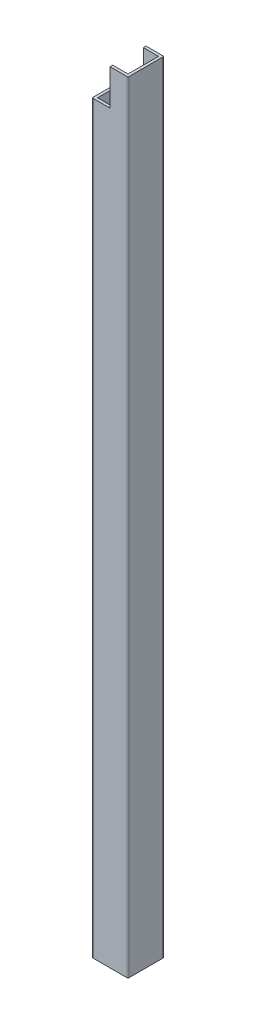
from build123d import *

# Parameters (mm, degrees)
SKETCH1_W                   = 17
SKETCH1_H                   = 17
BOSS_EXTRUDE1_DEPTH         = 1220
CUT_EXTRUDE1_START          = -20
SKETCH2_W                   = 20
SKETCH2_H                   = 20
CUT_EXTRUDE1_DEPTH          = 10
CUT_EXTRUDE2_DEPTH          = 15
SKETCH4_W                   = 3
SKETCH4_H                   = 10
CUT_EXTRUDE3_DEPTH          = 10
SKETCH_PATTERN1_START       = -20
SKETCH_PATTERN1_DEPTH       = 15
SKETCH_PATTERN1_2_OUTLINE_W = 1.5
SKETCH_PATTERN1_2_OUTLINE_H = 10
SKETCH_PATTERN1_2_DEPTH     = 3
SKETCH6_W                   = 20
SKETCH6_H                   = 785
CUT_EXTRUDE4_DEPTH          = 1221.327824808


# Read off the part's stored shape, not the designer's step: Sketch-Pattern1
with BuildPart() as part:
    # Sketch1 → Boss-Extrude1 (new body)
    with BuildSketch(Plane(origin=(0, 0, 0), x_dir=(1, 0, 0), z_dir=(0, 1, 0))):
        with BuildLine():
            Line((0.5, 0), (19.5, 0))
            ThreePointArc((19.5, 0), (19.853553391, 0.146446609), (20, 0.5))
            Line((20, 0.5), (20, 19.5))
            ThreePointArc((20, 19.5), (19.853553391, 19.853553391), (19.5, 20))
            Line((19.5, 20), (0.5, 20))
            ThreePointArc((0.5, 20), (0.146446609, 19.853553391), (0, 19.5))
            Line((0, 19.5), (0, 0.5))
            ThreePointArc((0, 0.5), (0.146446609, 0.146446609), (0.5, 0))
        make_face()
        with Locations((10, 10)):
            Rectangle(SKETCH1_W, SKETCH1_H, mode=Mode.SUBTRACT)
    extrude(amount=BOSS_EXTRUDE1_DEPTH)

    # Sketch2 → Cut-Extrude1 (cut)
    with BuildSketch(Plane(origin=(20, 0, 0), x_dir=(0, 0, -1), z_dir=(1, 0, 0)).offset(CUT_EXTRUDE1_START)):
        with Locations((10, 1210)):
            Rectangle(SKETCH2_W, SKETCH2_H)
        with Locations((10, 10)):
            Rectangle(SKETCH2_W, SKETCH2_H)
    extrude(amount=CUT_EXTRUDE1_DEPTH, mode=Mode.SUBTRACT)

    # Sketch3 → Cut-Extrude2 (cut)
    with BuildSketch(Plane(origin=(0, 0, -20), x_dir=(-1, 0, 0), z_dir=(0, 0, -1))):
        Polygon((-15, 1115), (0, 1115), (0, 1120), (-9, 1120), (-9, 1130), (0, 1130), (0, 1135), (-15, 1135), align=None)
    extrude(amount=-CUT_EXTRUDE2_DEPTH, mode=Mode.SUBTRACT)

    # Sketch4 → Cut-Extrude3 (cut)
    with BuildSketch(Plane.ZY):
        with Locations((-18.5, 1125)):
            Rectangle(SKETCH4_W, SKETCH4_H)
    extrude(amount=-CUT_EXTRUDE3_DEPTH, mode=Mode.SUBTRACT)

    # Sketch-Pattern1 outline → Sketch-Pattern1 (cut)
    with BuildSketch(Plane.XY.offset(SKETCH_PATTERN1_START)):
        Polygon((15, 85), (15, 105), (0, 105), (0, 100), (1.5, 100), (1.5, 90), (0, 90), (0, 85), align=None)
        Polygon((1.5, 330), (1.5, 320), (0, 320), (0, 315), (15, 315), (15, 335), (0, 335), (0, 330), align=None)
        Polygon((1.5, 500), (1.5, 490), (0, 490), (0, 485), (15, 485), (15, 505), (0, 505), (0, 500), align=None)
        Polygon((1.5, 730), (1.5, 720), (0, 720), (0, 715), (15, 715), (15, 735), (0, 735), (0, 730), align=None)
        Polygon((1.5, 900), (1.5, 890), (0, 890), (0, 885), (15, 885), (15, 905), (0, 905), (0, 900), align=None)
    extrude(amount=SKETCH_PATTERN1_DEPTH, mode=Mode.SUBTRACT)

    # Sketch-Pattern1 2 outline → Sketch-Pattern1 2 (cut)
    with BuildSketch(Plane.XY.offset(SKETCH_PATTERN1_START)):
        with Locations((0.75, 95)):
            Rectangle(SKETCH_PATTERN1_2_OUTLINE_W, SKETCH_PATTERN1_2_OUTLINE_H)
        with Locations((0.75, 325)):
            Rectangle(SKETCH_PATTERN1_2_OUTLINE_W, SKETCH_PATTERN1_2_OUTLINE_H)
        with Locations((0.75, 495)):
            Rectangle(SKETCH_PATTERN1_2_OUTLINE_W, SKETCH_PATTERN1_2_OUTLINE_H)
        with Locations((0.75, 725)):
            Rectangle(SKETCH_PATTERN1_2_OUTLINE_W, SKETCH_PATTERN1_2_OUTLINE_H)
        with Locations((0.75, 895)):
            Rectangle(SKETCH_PATTERN1_2_OUTLINE_W, SKETCH_PATTERN1_2_OUTLINE_H)
    extrude(amount=SKETCH_PATTERN1_2_DEPTH, mode=Mode.SUBTRACT)

    # Sketch6 → Cut-Extrude4 (cut, through all)
    with BuildSketch(Plane(origin=(0, 0, -20), x_dir=(-1, 0, 0), z_dir=(0, 0, -1))):
        with Locations((-10, 392.5)):
            Rectangle(SKETCH6_W, SKETCH6_H)
    extrude(amount=-CUT_EXTRUDE4_DEPTH, mode=Mode.SUBTRACT)


solid = part.part
